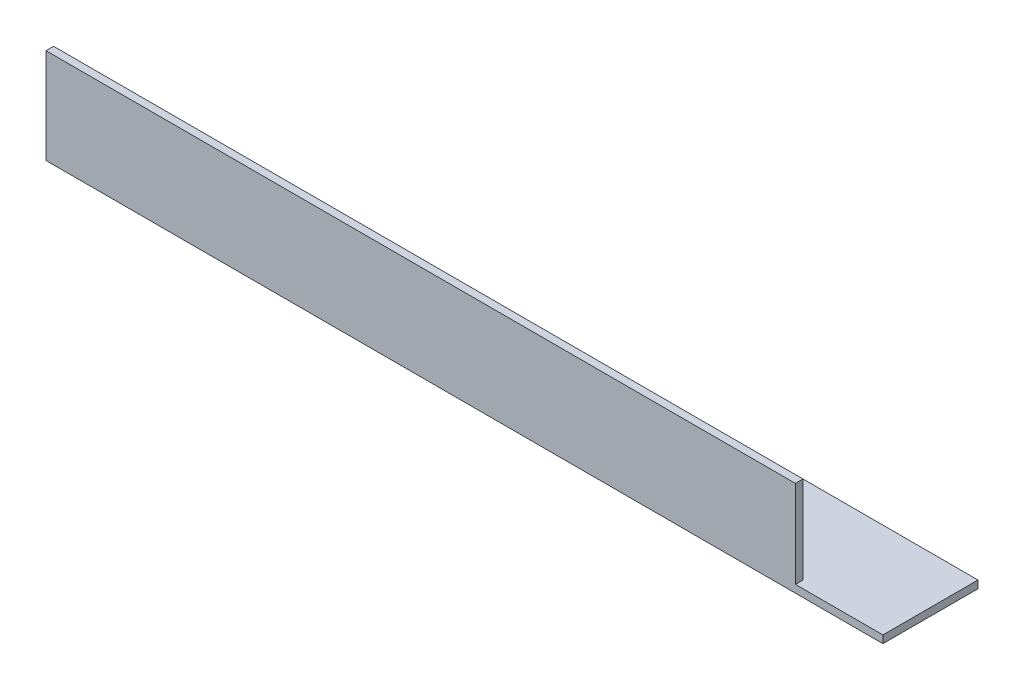
from build123d import *

# Parameters (mm, degrees)
EXTRUDE_1_DEPTH     = 220
SKETCH_3_W          = 23
SKETCH_3_H          = 23
CUT_EXTRUDE_1_DEPTH = 223.822799552


with BuildPart() as part:
    # Эскиз1 → Вытянуть-Тонкостенный1 (new body)
    with BuildSketch(Plane(origin=(0, 0, 0), x_dir=(0, 0, -1), z_dir=(1, 0, 0))):
        Polygon((0, 25), (0, 0), (25, 0), (25, 2), (2, 2), (2, 25), align=None)
    extrude(amount=EXTRUDE_1_DEPTH)

    # Эскиз3 → Вырез-Вытянуть1 (cut, through all)
    with BuildSketch(Plane.XY):
        with Locations((208.5, 13.5)):
            Rectangle(SKETCH_3_W, SKETCH_3_H)
    extrude(amount=-CUT_EXTRUDE_1_DEPTH, mode=Mode.SUBTRACT)


solid = part.part
